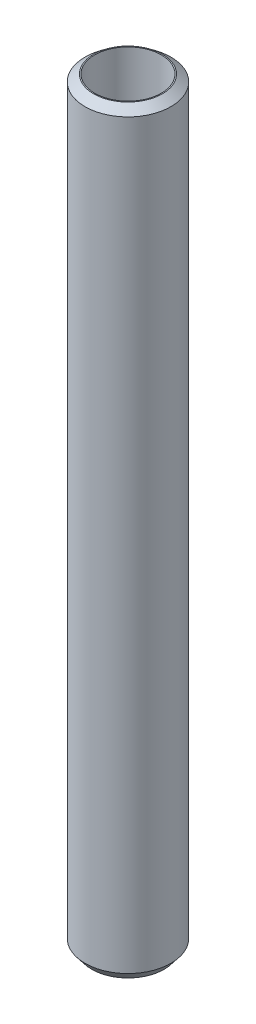
from build123d import *
from OCP.BRepFilletAPI import BRepFilletAPI_MakeChamfer

# Parameters (mm, degrees)
SKETCH1_R           = 27.5
BOSS_EXTRUDE1_DEPTH = 484.599302331
SKETCH2_R           = 21.28737474
CUT_EXTRUDE1_DEPTH  = 487.157365284
CHAMFER1_SIZE       = 4.328492803
CHAMFER1_SIZE2      = 5.517356365


with BuildPart() as part:
    # Sketch1 → Boss-Extrude1 (new body)
    with BuildSketch(Plane(origin=(0, 0, 0), x_dir=(1, 0, 0), z_dir=(0, 1, 0))):
        Circle(SKETCH1_R)
    extrude(amount=BOSS_EXTRUDE1_DEPTH)

    # Sketch2 → Cut-Extrude1 (cut, through all)
    with BuildSketch(Plane(origin=(0, 0, 0), x_dir=(1, 0, 0), z_dir=(0, 1, 0))):
        Circle(SKETCH2_R)
    extrude(amount=CUT_EXTRUDE1_DEPTH, mode=Mode.SUBTRACT)

    # Chamfer1: one chamfer whose edges measure the first distance from different faces: ONE call of the kernel's chamfer builder (chamfer() names one face for all edges)
    chamfer1_edges_1 = [part.edges().sort_by_distance(p)[0] for p in [
        (-27.5, 484.599302331, 0),
    ]]
    chamfer1_side_1 = [part.faces().sort_by_distance(p)[0] for p in [
        (-27.5, 242.299651166, 0),
    ]]
    chamfer1_edges_2 = [part.edges().sort_by_distance(p)[0] for p in [
        (-27.5, 0, 0),
    ]]
    chamfer1_side_2 = [part.faces().sort_by_distance(p)[0] for p in [
        (-26.722182541, 0, 0),
    ]]
    chamfer1 = BRepFilletAPI_MakeChamfer(part.part.solid().wrapped)
    for e in chamfer1_edges_1:
        chamfer1.Add(CHAMFER1_SIZE, CHAMFER1_SIZE2, e.wrapped, chamfer1_side_1[0].wrapped)  # the first distance lies on this face
    for e in chamfer1_edges_2:
        chamfer1.Add(CHAMFER1_SIZE, CHAMFER1_SIZE2, e.wrapped, chamfer1_side_2[0].wrapped)  # the first distance lies on this face
    add(Compound.cast(chamfer1.Shape()), mode=Mode.REPLACE)


solid = part.part
